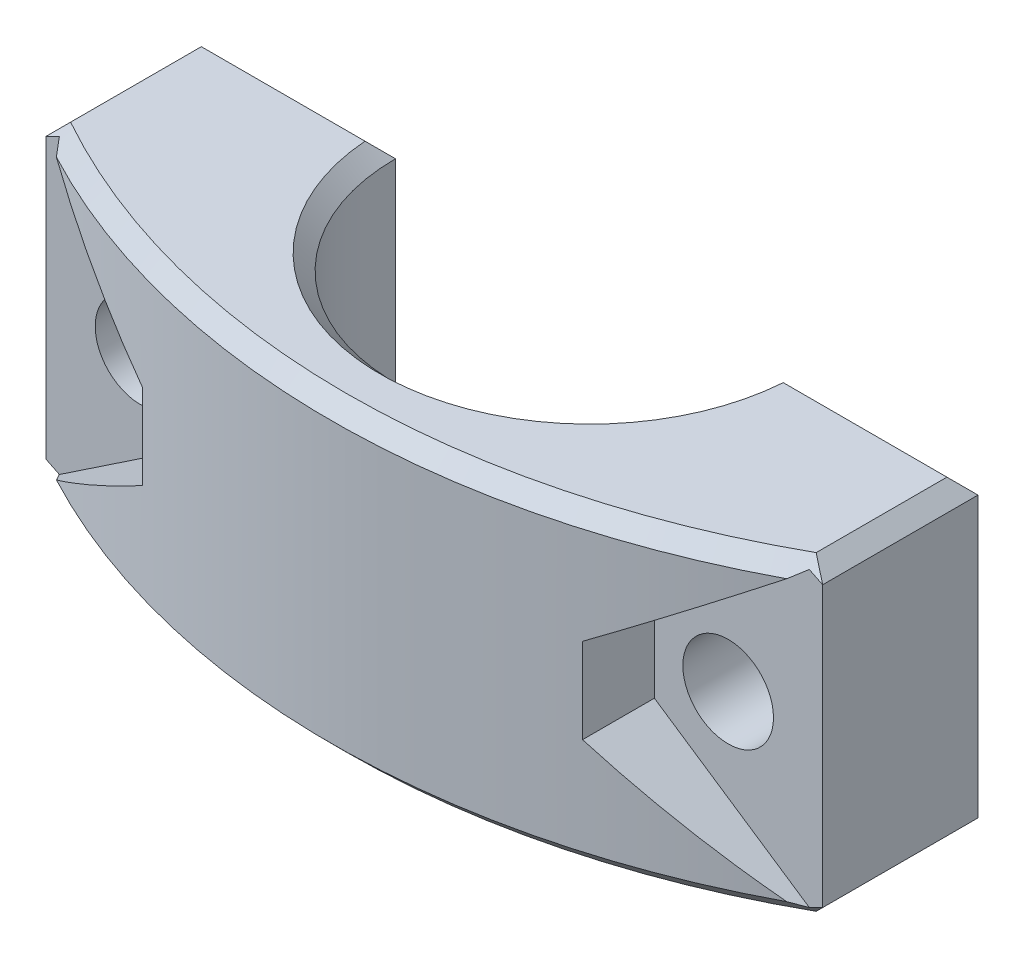
from build123d import *

# Parameters (mm, degrees)
ESBO_O1_W                  = 30
ESBO_O1_H                  = 12
RESSALTO_EXTRUS_O1_DEPTH   = 5
CORTE_EXTRUS_O1_DEPTH      = 20.849433241
CORTE_EXTRUS_O1_DEPTH_BACK = 20.849433241
ESBO_O3_R                  = 1.75
CORTE_EXTRUS_O2_DEPTH      = 20
ESBO_O4_R                  = 1.75
CORTE_EXTRUS_O3_DEPTH      = 4
CORTE_EXTRUS_O4_DEPTH      = 20.849433241
CORTE_EXTRUS_O4_DEPTH_BACK = 20.849433241
CHANFRO2_SIZE              = 0.6


with BuildPart() as part:
    # Esboço1 → Ressalto-extrusão1 (new, symmetric)
    with BuildSketch(Plane.XY):
        Rectangle(ESBO_O1_W, ESBO_O1_H)
    extrude(amount=RESSALTO_EXTRUS_O1_DEPTH, both=True)

    # Esboço2 → Corte-extrusão1 (cut, two sides: drawn at the far end of the back side and taken through both)
    with BuildSketch(Plane(origin=(0, 6, 0), x_dir=(1, 0, 0), z_dir=(0, 1, 0)).offset(-CORTE_EXTRUS_O1_DEPTH_BACK)):
        with BuildLine():
            Line((-7.5, 64.244289009), (-7.5, 5))
            ThreePointArc((-7.5, 5), (0, -2.5), (7.5, 5))
            Line((7.5, 5), (7.5, 64.244289009))
            Line((7.5, 64.244289009), (7.5, 182.732867027))
            Line((7.5, 182.732867027), (-7.5, 182.732867027))
            Line((-7.5, 182.732867027), (-7.5, 64.244289009))
        make_face()
    extrude(amount=CORTE_EXTRUS_O1_DEPTH + CORTE_EXTRUS_O1_DEPTH_BACK, mode=Mode.SUBTRACT)

    # Esboço3 → Corte-extrusão2 (cut, through all)
    with BuildSketch(Plane.XY.offset(5)):
        with Locations((11.35, 0)):
            Circle(ESBO_O3_R)
    corte_extrus_o2 = extrude(amount=-CORTE_EXTRUS_O2_DEPTH, mode=Mode.SUBTRACT)

    # Espelhar1: Corte-extrusão2 across plane
    add(corte_extrus_o2.mirror(Plane(origin=(0, 0, 0), x_dir=(0, 0, 1), z_dir=(1, 0, 0))), mode=Mode.SUBTRACT)

    # Esboço4 → Corte-extrusão3 (cut)
    # profile 1 of 2: a face of its own
    with BuildSketch(Plane.XY.offset(5)):
        Polygon((-15, -6), (-8.5, -1.645448267), (-11.35, -3.290896534), (-14.2, -1.645448267), (-14.2, 1.645448267), (-11.35, 3.290896534), (-8.5, 1.645448267), (-15, 6), align=None)
    # profile 2 of 2: a face of its own
    with BuildSketch(Plane.XY.offset(5)):
        Polygon((-11.35, -3.290896534), (-8.5, -1.645448267), (-8.5, 1.645448267), (-11.35, 3.290896534), (-14.2, 1.645448267), (-14.2, -1.645448267), align=None)
        with Locations((-11.35, 0)):
            Circle(ESBO_O4_R, mode=Mode.SUBTRACT)
    corte_extrus_o3 = extrude(amount=-CORTE_EXTRUS_O3_DEPTH, mode=Mode.SUBTRACT)

    # Espelhar2: Corte-extrusão3 across plane
    add(corte_extrus_o3.mirror(Plane(origin=(0, 0, 0), x_dir=(0, 0, 1), z_dir=(1, 0, 0))), mode=Mode.SUBTRACT)

    # Esboço5 → Corte-extrusão4 (cut, two sides: drawn at the far end of the back side and taken through both)
    with BuildSketch(Plane.XZ.offset(6).offset(-CORTE_EXTRUS_O4_DEPTH_BACK)):
        with BuildLine():
            Line((-76.735854523, -34.44642365), (-15, 1))
            ThreePointArc((-15, 1), (0, 5), (15, 1))
            Line((15, 1), (76.735854523, -34.44642365))
            Line((76.735854523, -34.44642365), (76.735854523, 107.930044677))
            Line((76.735854523, 107.930044677), (-76.735854523, 107.930044677))
            Line((-76.735854523, 107.930044677), (-76.735854523, -34.44642365))
        make_face()
    extrude(amount=CORTE_EXTRUS_O4_DEPTH + CORTE_EXTRUS_O4_DEPTH_BACK, mode=Mode.SUBTRACT)

    # Chanfro2
    # the kernel refuses this chamfer: 0.6 mm, written as the material it takes off along each edge
    with BuildSketch(Plane(origin=(-15, 6, -6.543009793), x_dir=(0.9996219169112968, 0.027495876610585904, 0), z_dir=(0, 0, 1)), Plane(origin=(15, 6, 2.543009793), x_dir=(-0.9996219169112968, 0.027495876610585824, 0), z_dir=(0, 0, -1))) as chanfro2_piece_1:
        Polygon((CHANFRO2_SIZE * 0.999621916911, -CHANFRO2_SIZE * 0.0274958766106), (-CHANFRO2_SIZE * 0.0274958766106, -CHANFRO2_SIZE * 0.999621916911), (0, 0), align=None)
    extrude(amount=9.086019586, mode=Mode.SUBTRACT)
    with BuildSketch(Plane(origin=(-16.543009793, 6, -5), x_dir=(0, 0.027495876610585942, 0.9996219169112968), z_dir=(1, 0, 0)), Plane(origin=(5.956990207, 6, -5), x_dir=(0, 0.027495876610585942, 0.9996219169112968), z_dir=(1, 0, 0)), Plane(origin=(16.543009793, -6, -5), x_dir=(0, -0.027495876610585942, 0.9996219169112968), z_dir=(-1, 0, 0)), Plane(origin=(-5.956990207, -6, -5), x_dir=(0, -0.027495876610585942, 0.9996219169112968), z_dir=(-1, 0, 0))) as chanfro2_piece_2:
        Polygon((CHANFRO2_SIZE * 0.999621916911, CHANFRO2_SIZE * 0.0274958766106), (-CHANFRO2_SIZE * 0.0274958766106, CHANFRO2_SIZE * 0.999621916911), (0, 0), align=None)
    extrude(amount=10.586019586, mode=Mode.SUBTRACT)
    with BuildSketch(Plane(origin=(0, 6, -5), x_dir=(0.9788435281484443, 0, -0.20461023288659222), z_dir=(-0.20461023288659222, 0, -0.9788435281484443))) as chanfro2_piece_3:
        Polygon((7.5 + CHANFRO2_SIZE, 0), (7.5, CHANFRO2_SIZE), (7.5, 0), align=None)
    revolve(axis=Axis((0, 6, -5), (0, -1, 0)), revolution_arc=203.613366819, mode=Mode.SUBTRACT)
    with BuildSketch(Plane(origin=(0, 6, -25.125), x_dir=(-0.5416797070080789, 0, 0.8405849719187476), z_dir=(-0.8405849719187476, 0, -0.5416797070080789))) as chanfro2_piece_4:
        Polygon((30.125 - CHANFRO2_SIZE, 0), (30.125, -CHANFRO2_SIZE), (30.125, 0), align=None)
    revolve(axis=Axis((0, 6, -25.125), (0, 1, 0)), revolution_arc=65.596114289, mode=Mode.SUBTRACT)
    with BuildSketch(Plane(origin=(0, -6, -5), x_dir=(0.9788435281484443, 0, -0.20461023288659222), z_dir=(-0.20461023288659222, 0, -0.9788435281484443))) as chanfro2_piece_5:
        Polygon((7.5 + CHANFRO2_SIZE, 0), (7.5, -CHANFRO2_SIZE), (7.5, 0), align=None)
    revolve(axis=Axis((0, -6, -5), (0, -1, 0)), revolution_arc=203.613366819, mode=Mode.SUBTRACT)
    with BuildSketch(Plane(origin=(-15, -6, -6.543009793), x_dir=(0.9996219169112968, -0.027495876610585824, 0), z_dir=(0, 0, 1)), Plane(origin=(15, -6, 2.543009793), x_dir=(-0.9996219169112968, -0.027495876610585904, 0), z_dir=(0, 0, -1))) as chanfro2_piece_6:
        Polygon((CHANFRO2_SIZE * 0.999621916911, CHANFRO2_SIZE * 0.0274958766106), (-CHANFRO2_SIZE * 0.0274958766106, CHANFRO2_SIZE * 0.999621916911), (0, 0), align=None)
    extrude(amount=9.086019586, mode=Mode.SUBTRACT)
    with BuildSketch(Plane(origin=(0, -6, -25.125), x_dir=(-0.5416797070080789, 0, 0.8405849719187476), z_dir=(-0.8405849719187476, 0, -0.5416797070080789))) as chanfro2_piece_7:
        Polygon((30.125, CHANFRO2_SIZE), (30.125 - CHANFRO2_SIZE, 0), (30.125, 0), align=None)
    revolve(axis=Axis((0, -6, -25.125), (0, 1, 0)), revolution_arc=65.596114289, mode=Mode.SUBTRACT)


solid = part.part
